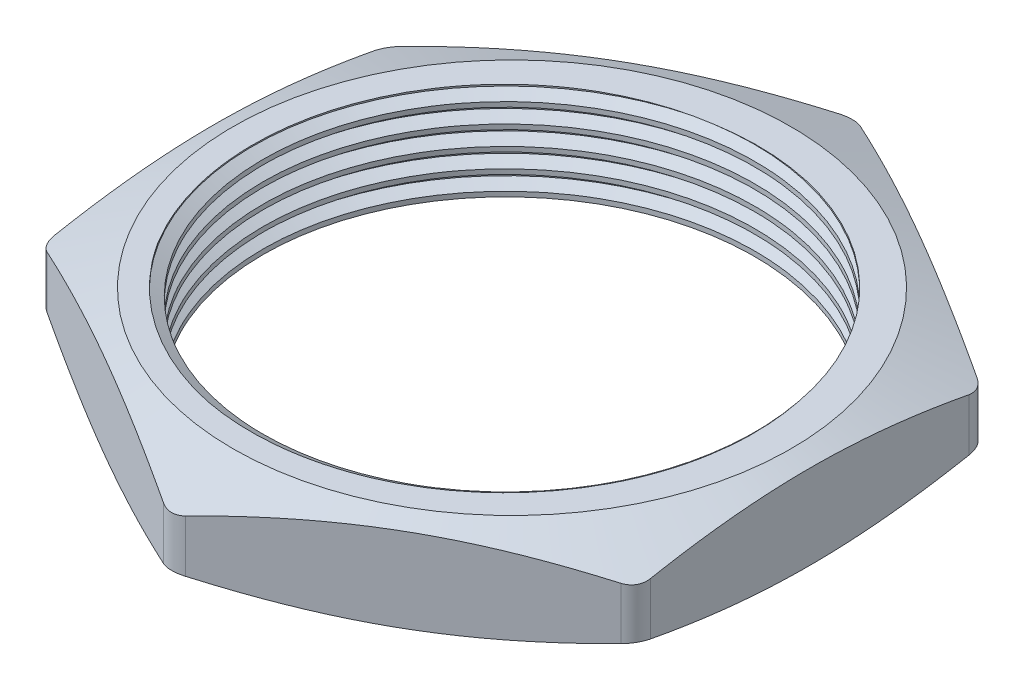
from build123d import *

# Parameters (mm, degrees)
SKETCH_1_R      = 5.7
EXTRUDE_1_DEPTH = 1.15
FILLET_1_R      = 0.5
THREAD_1_PITCH  = 0.45


with BuildPart() as part:
    # Эскиз1 → Бобышка-Вытянуть1 (new, symmetric)
    with BuildSketch(Plane(origin=(0, 0, 0), x_dir=(1, 0, 0), z_dir=(0, 1, 0))):
        Polygon((0, 7.967433715), (-6.9, 3.983716857), (-6.9, -3.983716857), (0, -7.967433715), (6.9, -3.983716857), (6.9, 3.983716857), align=None)
        with Locations(Location((0, 0, 0), (0, 0, 270))):
            Circle(SKETCH_1_R, mode=Mode.SUBTRACT)
    extrude(amount=EXTRUDE_1_DEPTH, both=True)

    # Sketch 2 → Вырез-Повернуть1 (revolve, cut)
    with BuildSketch(Plane(origin=(0, 0, 0), x_dir=(0, 0, -1), z_dir=(1, 0, 0))):
        Polygon((-7.967433715, 0.55), (-7.967433715, 1.15), (-6.467433715, 1.15), align=None)
        Polygon((-7.967433715, -0.55), (-7.967433715, -1.15), (-6.467433715, -1.15), align=None)
    revolve(axis=Axis((0, 7.461835903, 0), (0, -1, 0)), mode=Mode.SUBTRACT)

    # Скругление1
    # the kernel refuses this fillet: 0.5 mm, written as the material it takes off along each edge
    with BuildSketch(Plane(origin=(0, 1.271687836, -7.967433715), x_dir=(-0.8660254037844384, 0, 0.5000000000000006), z_dir=(0, -1, 0)), Plane(origin=(6.9, 1.271687836, -3.983716857), x_dir=(-0.8660254037844419, 0, -0.49999999999999434), z_dir=(0, -1, 0)), Plane(origin=(-6.9, -1.271687836, 3.983716857), x_dir=(0, 0, -1), z_dir=(0, 1, 0)), Plane(origin=(-6.9, -1.271687836, -3.983716857), x_dir=(0.8660254037844378, 0, -0.5000000000000014), z_dir=(0, 1, 0)), Plane(origin=(6.9, 1.271687836, 3.983716857), x_dir=(0, 0, -1), z_dir=(0, -1, 0)), Plane(origin=(0, -1.271687836, 7.967433715), x_dir=(-0.8660254037844427, 0, -0.4999999999999928), z_dir=(0, 1, 0))) as fillet_1_piece_1:
        with BuildLine():
            CenterArc((FILLET_1_R * 0.57735026919, -FILLET_1_R), FILLET_1_R, 90, 60)
            Line((-FILLET_1_R * 0.288675134595, -FILLET_1_R * 0.5), (0, 0))
            Line((0, 0), (FILLET_1_R * 0.57735026919, 0))
        make_face()
    extrude(amount=2.543375673, mode=Mode.SUBTRACT)

    # Резьба1: the profile of Sketch 2 2 profile screwed along a right-hand helix of 8.888889 turns, 6 arcs to a turn; built about Z, then put on its axis
    thread_1_z = Axis((0, 0, 0), (0, 0, 1))
    thread_1_corners = [(5.6997, 0, -0.000173205), (5.943569644, 0, 0.140624999), (5.943569644, 0, 0.196874999), (5.6997, 0, 0.337673204)]
    with BuildLine(mode=Mode.PRIVATE) as thread_1_profile:
        Line(thread_1_corners[0], thread_1_corners[1])
        Line(thread_1_corners[1], thread_1_corners[2])
        Line(thread_1_corners[2], thread_1_corners[3])
        Line(thread_1_corners[3], thread_1_corners[0])
    thread_1_cap = Face(thread_1_profile.wire())
    thread_1_turn_angles = [0, 30, 60, 90, 120, 150, 180, 210, 240, 270, 300, 330, 360]
    thread_1_turn_weights = [1, 0.8660254037844387, 1, 0.8660254037844387, 1, 0.8660254037844387, 1, 0.8660254037844387, 1, 0.8660254037844387, 1, 0.8660254037844387, 1]
    thread_1_turn_rails = [Edge.make_bspline([Vector(p[0], p[1], 0).rotate(thread_1_z, thread_1_turn_angles[k]) / thread_1_turn_weights[k] + Vector(0, 0, p[2] + THREAD_1_PITCH * thread_1_turn_angles[k] / 360) for k in range(13)], [0, 0, 0, 1, 1, 2, 2, 3, 3, 4, 4, 5, 5, 6, 6, 6], 2, thread_1_turn_weights) for p in thread_1_corners]
    thread_1_turn_sides = [Face.make_surface_from_curves(thread_1_turn_rails[p[0]], thread_1_turn_rails[p[1]]) for p in [(0, 1), (1, 2), (2, 3), (3, 0)]]
    thread_1_last_angles = [2880, 2910, 2940, 2970, 3000, 3030, 3060, 3090, 3120, 3150, 3180, 3190, 3200]
    thread_1_last_weights = [1, 0.8660254037844387, 1, 0.8660254037844387, 1, 0.8660254037844387, 1, 0.8660254037844387, 1, 0.8660254037844387, 1, 0.9848077530122074, 1]
    thread_1_last_rails = [Edge.make_bspline([Vector(p[0], p[1], 0).rotate(thread_1_z, thread_1_last_angles[k]) / thread_1_last_weights[k] + Vector(0, 0, p[2] + THREAD_1_PITCH * thread_1_last_angles[k] / 360) for k in range(13)], [0, 0, 0, 1, 1, 2, 2, 3, 3, 4, 4, 5, 5, 6, 6, 6], 2, thread_1_last_weights) for p in thread_1_corners]
    thread_1_last_sides = [Face.make_surface_from_curves(thread_1_last_rails[p[0]], thread_1_last_rails[p[1]]) for p in [(0, 1), (1, 2), (2, 3), (3, 0)]]
    thread_1 = Plane(origin=(0, 2.15, 0), x_dir=(-1, 0, 0), z_dir=(0, -1, 0)) * Solid(Shell([*[p.moved(Location((0, 0, THREAD_1_PITCH * i))) for i in range(8) for p in thread_1_turn_sides], *thread_1_last_sides, thread_1_cap, thread_1_cap.rotate(thread_1_z, 3200).moved(Location((0, 0, THREAD_1_PITCH * 3200 / 360)))]))
    add(thread_1, mode=Mode.SUBTRACT)


solid = part.part
